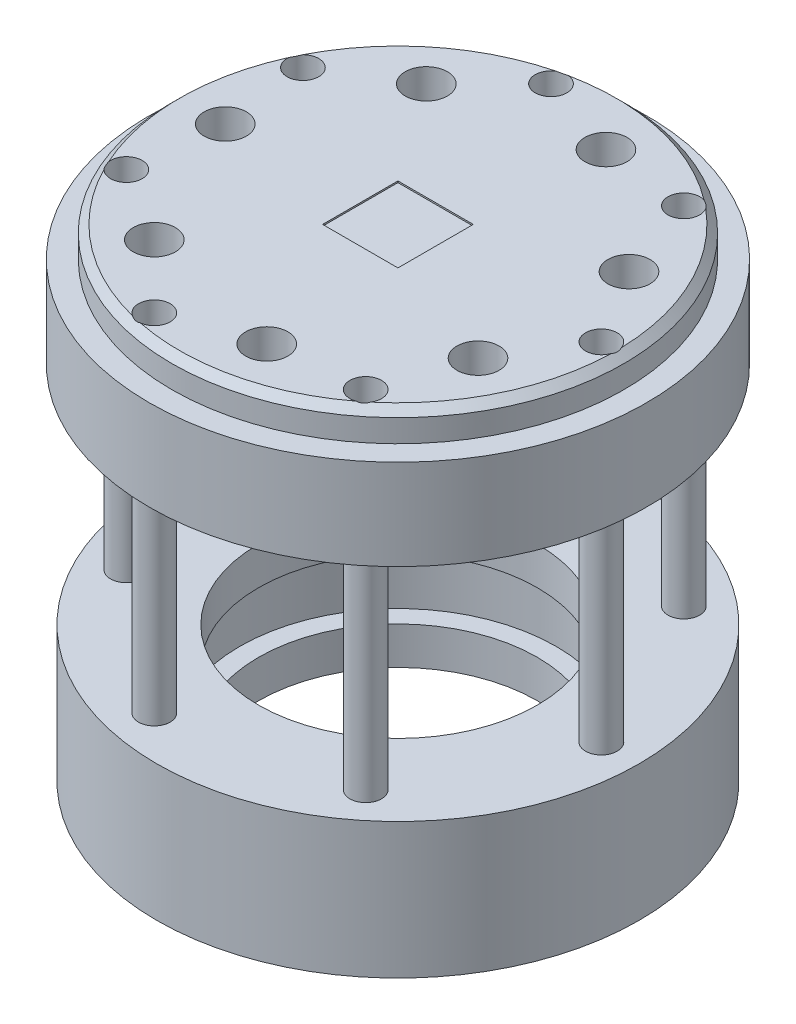
from build123d import *

# Parameters (mm, degrees)
SKETCH1_R           = 16
SKETCH1_R_2         = 10.5
BOSS_EXTRUDE1_DEPTH = 9
SKETCH2_R           = 1.05
BOSS_EXTRUDE2_DEPTH = 15
BOSS_EXTRUDE3_START = -2.5
SKETCH3_R           = 10.5
SKETCH3_R_2         = 9.25
BOSS_EXTRUDE3_DEPTH = 2.5
BOSS_EXTRUDE4_START = -9
SKETCH3_3_R         = 10.5
SKETCH3_3_R_2       = 9.25
BOSS_EXTRUDE4_DEPTH = 2.5
SKETCH4_R           = 16.5
BOSS_EXTRUDE5_DEPTH = 6
SKETCH6_R           = 15
BOSS_EXTRUDE6_DEPTH = 2
SKETCH8_R           = 7.5
CUT_EXTRUDE1_DEPTH  = 4
CHAMFER1_SIZE       = 0.5
SKETCH9_R           = 6
CUT_EXTRUDE2_DEPTH  = 1.5
CHAMFER2_SIZE       = 0.5
CUT_EXTRUDE3_START  = -7
SKETCH10_R          = 1.05
CUT_EXTRUDE3_DEPTH  = 7
SKETCH11_R          = 1.05
CUT_EXTRUDE4_DEPTH  = 8
SKETCH12_R          = 3
CUT_EXTRUDE5_DEPTH  = 5
SKETCH13_R          = 1.4
CUT_EXTRUDE6_DEPTH  = 3
CIRPATTERN1_COUNT   = 7
CHAMFER3_SIZE       = 0.5
SKETCH14_W          = 5
SKETCH14_H          = 5
CUT_EXTRUDE7_DEPTH  = 0.1


with BuildPart() as part:
    # Sketch1 → Boss-Extrude1 (new body)
    with BuildSketch(Plane(origin=(0, 0, 0), x_dir=(1, 0, 0), z_dir=(0, 1, 0))):
        with Locations(Location((0, 0, 0), (0, 0, 270))):
            Circle(SKETCH1_R)
        with Locations(Location((0, 0, 0), (0, 0, 270))):
            Circle(SKETCH1_R_2, mode=Mode.SUBTRACT)
    extrude(amount=BOSS_EXTRUDE1_DEPTH)

    # Sketch2 → Boss-Extrude2 (add)
    with BuildSketch(Plane(origin=(0, 9, 0), x_dir=(1, 0, 0), z_dir=(0, 1, 0))):
        with Locations(Location((13.5, 0, 0), (0, 0, 270))):
            Circle(SKETCH2_R)
        with Locations(Location((8.417112325, -10.554725013, 0), (0, 0, 270))):
            Circle(SKETCH2_R)
        with Locations(Location((-3.004032608, -13.161526814, 0), (0, 0, 270))):
            Circle(SKETCH2_R)
        with Locations(Location((-12.163079717, -5.857430478, 0), (0, 0, 270))):
            Circle(SKETCH2_R)
        with Locations(Location((-12.163079717, 5.857430478, 0), (0, 0, 270))):
            Circle(SKETCH2_R)
        with Locations(Location((-3.004032608, 13.161526814, 0), (0, 0, 270))):
            Circle(SKETCH2_R)
        with Locations(Location((8.417112325, 10.554725013, 0), (0, 0, 270))):
            Circle(SKETCH2_R)
    extrude(amount=BOSS_EXTRUDE2_DEPTH)

    # Sketch3 → Boss-Extrude3 (add)
    with BuildSketch(Plane(origin=(0, 9, 0), x_dir=(1, 0, 0), z_dir=(0, 1, 0)).offset(BOSS_EXTRUDE3_START)):
        with Locations(Location((0, 0, 0), (0, 0, 270))):
            Circle(SKETCH3_R)
        with Locations(Location((0, 0, 0), (0, 0, 270))):
            Circle(SKETCH3_R_2, mode=Mode.SUBTRACT)
    extrude(amount=BOSS_EXTRUDE3_DEPTH)

    # Sketch3<3> → Boss-Extrude4 (add)
    with BuildSketch(Plane(origin=(0, 9, 0), x_dir=(1, 0, 0), z_dir=(0, 1, 0)).offset(BOSS_EXTRUDE4_START)):
        with Locations(Location((0, 0, 0), (0, 0, 270))):
            Circle(SKETCH3_3_R)
        with Locations(Location((0, 0, 0), (0, 0, 270))):
            Circle(SKETCH3_3_R_2, mode=Mode.SUBTRACT)
    extrude(amount=BOSS_EXTRUDE4_DEPTH)

    # Sketch4 → Boss-Extrude5 (add)
    with BuildSketch(Plane(origin=(0, 24, 0), x_dir=(1, 0, 0), z_dir=(0, 1, 0))):
        with Locations(Location((0, 0, 0), (0, 0, 270))):
            Circle(SKETCH4_R)
    extrude(amount=BOSS_EXTRUDE5_DEPTH)

    # Sketch6 → Boss-Extrude6 (add)
    with BuildSketch(Plane(origin=(0, 30, 0), x_dir=(1, 0, 0), z_dir=(0, 1, 0))):
        with Locations(Location((0, 0, 0), (0, 0, 270))):
            Circle(SKETCH6_R)
    extrude(amount=BOSS_EXTRUDE6_DEPTH)

    # Sketch8 → Cut-Extrude1 (cut)
    with BuildSketch(Plane.XZ.offset(-24)):
        with Locations(Location((0, 0, 0), (0, 0, 270))):
            Circle(SKETCH8_R)
    extrude(amount=-CUT_EXTRUDE1_DEPTH, mode=Mode.SUBTRACT)

    # Chamfer1
    chamfer1_edges = [part.edges().sort_by_distance(p)[0] for p in [
        (0, 24, 7.5),
    ]]
    chamfer(chamfer1_edges, length=CHAMFER1_SIZE)

    # Sketch9 → Cut-Extrude2 (cut)
    with BuildSketch(Plane.XZ.offset(-28)):
        with Locations(Location((0, 0, 0), (0, 0, 270))):
            Circle(SKETCH9_R)
    extrude(amount=-CUT_EXTRUDE2_DEPTH, mode=Mode.SUBTRACT)

    # Chamfer2
    chamfer2_edges = [part.edges().sort_by_distance(p)[0] for p in [
        (0, 32, -15),
    ]]
    chamfer(chamfer2_edges, length=CHAMFER2_SIZE)

    # Sketch10 → Cut-Extrude3 (cut)
    with BuildSketch(Plane(origin=(0, 9, 0), x_dir=(1, 0, 0), z_dir=(0, 1, 0)).offset(CUT_EXTRUDE3_START)):
        with Locations(Location((8.417112325, -10.554725013, 0), (0, 0, 270))):
            Circle(SKETCH10_R)
        with Locations(Location((13.5, 0, 0), (0, 0, 270))):
            Circle(SKETCH10_R)
        with Locations(Location((8.417112325, 10.554725013, 0), (0, 0, 270))):
            Circle(SKETCH10_R)
        with Locations(Location((-3.004032608, 13.161526814, 0), (0, 0, 270))):
            Circle(SKETCH10_R)
        with Locations(Location((-12.163079717, 5.857430478, 0), (0, 0, 270))):
            Circle(SKETCH10_R)
        with Locations(Location((-12.163079717, -5.857430478, 0), (0, 0, 270))):
            Circle(SKETCH10_R)
        with Locations(Location((-3.004032608, -13.161526814, 0), (0, 0, 270))):
            Circle(SKETCH10_R)
    extrude(amount=CUT_EXTRUDE3_DEPTH, mode=Mode.SUBTRACT)


with BuildPart() as cut_extrude3_piece_1:
    # of the separate pieces the step leaves, piece 1, a body of its own (cut_extrude3_pieces)
    add(part.part.solids().sort_by_distance((0, 31.5, 15))[0])

    # Sketch11 → Cut-Extrude4 (cut)
    with BuildSketch(Plane.XZ.offset(-24)):
        with Locations(Location((8.417112325, -10.554725013, 0), (0, 0, 270))):
            Circle(SKETCH11_R)
        with Locations(Location((-3.004032608, -13.161526814, 0), (0, 0, 270))):
            Circle(SKETCH11_R)
        with Locations(Location((-12.163079717, -5.857430478, 0), (0, 0, 270))):
            Circle(SKETCH11_R)
        with Locations(Location((-12.163079717, 5.857430478, 0), (0, 0, 270))):
            Circle(SKETCH11_R)
        with Locations(Location((-3.004032608, 13.161526814, 0), (0, 0, 270))):
            Circle(SKETCH11_R)
        with Locations(Location((8.417112325, 10.554725013, 0), (0, 0, 270))):
            Circle(SKETCH11_R)
        with Locations(Location((13.5, 0, 0), (0, 0, 270))):
            Circle(SKETCH11_R)
    extrude(amount=-CUT_EXTRUDE4_DEPTH, mode=Mode.SUBTRACT)


with BuildPart() as cut_extrude3_piece_2:
    # of the separate pieces the step leaves, piece 2, a body of its own (cut_extrude3_pieces)
    add(part.part.solids().sort_by_distance((0, 9, 16))[0])


with BuildPart() as cut_extrude4_piece_1:
    # of the separate pieces the step leaves, piece 1, a body of its own (cut_extrude4_pieces)
    add(cut_extrude3_piece_1.part.solids().sort_by_distance((0, 31.5, 15))[0])

    # Sketch12 → Cut-Extrude5 (cut)
    with BuildSketch(Plane(origin=(0, 24, 0), x_dir=(1, 0, 0), z_dir=(0, 1, 0))):
        with Locations(Location((10.37973077, 4.950877613, 0), (0, 0, 270))):
            Circle(SKETCH12_R)
    cut_extrude5 = extrude(amount=CUT_EXTRUDE5_DEPTH, mode=Mode.SUBTRACT)

    # Sketch13 → Cut-Extrude6 (cut)
    with BuildSketch(Plane.XZ.offset(-29)):
        with Locations(Location((10.37973077, -4.950877613, 0), (0, 0, 270))):
            Circle(SKETCH13_R)
    cut_extrude6 = extrude(amount=-CUT_EXTRUDE6_DEPTH, mode=Mode.SUBTRACT)

    # CirPattern1: Cut-Extrude5, Cut-Extrude6 ×7 about axis
    cirpattern1_axis = Axis((0, 0, 0), (0, 1, 0))
    add([cut_extrude5.rotate(cirpattern1_axis, i * 360 / CIRPATTERN1_COUNT) for i in range(1, CIRPATTERN1_COUNT)], mode=Mode.SUBTRACT)
    add([cut_extrude6.rotate(cirpattern1_axis, i * 360 / CIRPATTERN1_COUNT) for i in range(1, CIRPATTERN1_COUNT)], mode=Mode.SUBTRACT)

    # Chamfer3
    chamfer3_edges = [cut_extrude4_piece_1.edges().sort_by_distance(p)[0] for p in [
        (10.37973077, 24, -7.950877613),
        (12.687902712, 24, 3.157909188),
        (5.441825126, 24, 11.888725961),
        (-5.902057773, 24, 11.6670896),
        (-12.801570789, 24, 2.659896805),
        (-10.061239897, 24, -8.350252536),
        (0.25540985, 24, -13.072491403),
    ]]
    chamfer(chamfer3_edges, length=CHAMFER3_SIZE - 0.0001)  # a hair under: the kernel refuses the full size

    # Sketch14 → Cut-Extrude7 (cut)
    with BuildSketch(Plane(origin=(0, 32, 0), x_dir=(1, 0, 0), z_dir=(0, 1, 0))):
        Rectangle(SKETCH14_W, SKETCH14_H)
    extrude(amount=-CUT_EXTRUDE7_DEPTH, mode=Mode.SUBTRACT)


with BuildPart() as cut_extrude4_piece_2:
    # of the separate pieces the step leaves, piece 2, a body of its own (cut_extrude4_pieces)
    add(cut_extrude3_piece_1.part.solids().sort_by_distance((8.417112325, 9, -9.504725013))[0])


with BuildPart() as cut_extrude4_piece_3:
    # of the separate pieces the step leaves, piece 3, a body of its own (cut_extrude4_pieces)
    add(cut_extrude3_piece_1.part.solids().sort_by_distance((-3.004032608, 9, 14.211526814))[0])


with BuildPart() as cut_extrude4_piece_4:
    # of the separate pieces the step leaves, piece 4, a body of its own (cut_extrude4_pieces)
    add(cut_extrude3_piece_1.part.solids().sort_by_distance((-12.163079717, 9, -4.807430478))[0])


with BuildPart() as cut_extrude4_piece_5:
    # of the separate pieces the step leaves, piece 5, a body of its own (cut_extrude4_pieces)
    add(cut_extrude3_piece_1.part.solids().sort_by_distance((8.417112325, 9, 11.604725013))[0])


with BuildPart() as cut_extrude4_piece_6:
    # of the separate pieces the step leaves, piece 6, a body of its own (cut_extrude4_pieces)
    add(cut_extrude3_piece_1.part.solids().sort_by_distance((-12.163079717, 9, 6.907430478))[0])


with BuildPart() as cut_extrude4_piece_7:
    # of the separate pieces the step leaves, piece 7, a body of its own (cut_extrude4_pieces)
    add(cut_extrude3_piece_1.part.solids().sort_by_distance((-3.004032608, 9, -12.111526814))[0])


with BuildPart() as cut_extrude4_piece_8:
    # of the separate pieces the step leaves, piece 8, a body of its own (cut_extrude4_pieces)
    add(cut_extrude3_piece_1.part.solids().sort_by_distance((13.5, 9, 1.05))[0])


solid = Compound([cut_extrude3_piece_2.part, cut_extrude4_piece_1.part, cut_extrude4_piece_2.part, cut_extrude4_piece_3.part, cut_extrude4_piece_4.part, cut_extrude4_piece_5.part, cut_extrude4_piece_6.part, cut_extrude4_piece_7.part, cut_extrude4_piece_8.part])
